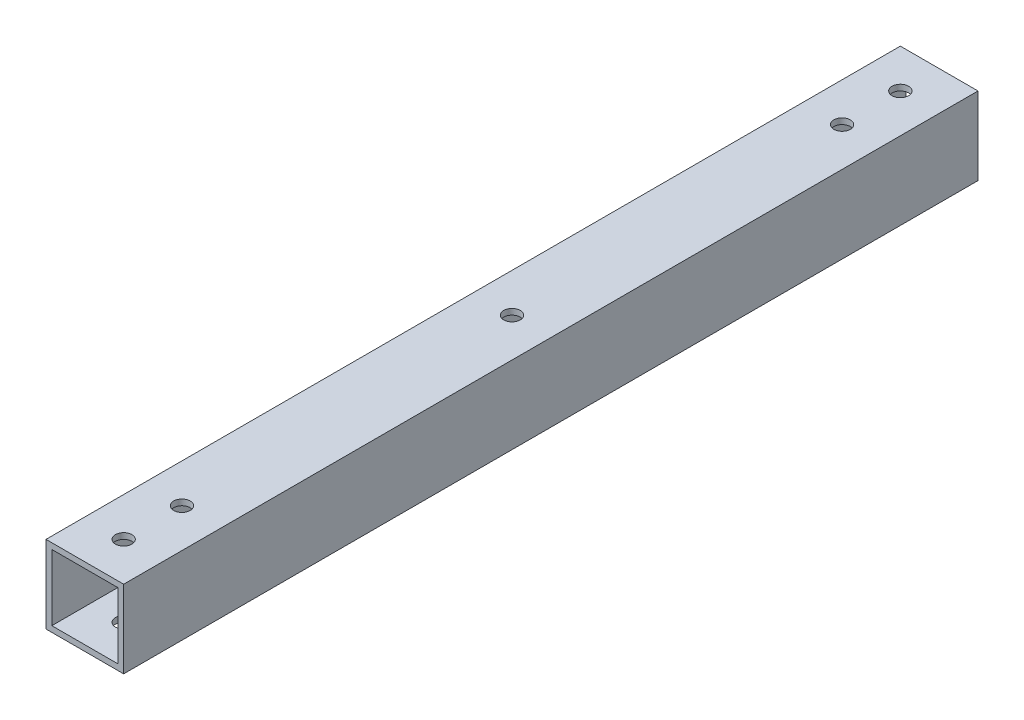
from build123d import *

# Parameters (mm, degrees)
SKETCH1_W           = 20
SKETCH1_H           = 20
SKETCH1_W_2         = 17
SKETCH1_H_2         = 17
BOSS_EXTRUDE1_DEPTH = 220
SKETCH2_R           = 2.125
CUT_EXTRUDE1_DEPTH  = 222.133443875


with BuildPart() as part:
    # Sketch1 → Boss-Extrude1 (new body)
    with BuildSketch(Plane.XY):
        Rectangle(SKETCH1_W, SKETCH1_H)
        Rectangle(SKETCH1_W_2, SKETCH1_H_2, mode=Mode.SUBTRACT)
    extrude(amount=-BOSS_EXTRUDE1_DEPTH)

    # Sketch2 → Cut-Extrude1 (cut, through all)
    with BuildSketch(Plane(origin=(0, 10, 0), x_dir=(1, 0, 0), z_dir=(0, 1, 0))):
        with Locations((0, 10)):
            Circle(SKETCH2_R)
        with Locations((0, 110)):
            Circle(SKETCH2_R)
        with Locations((0, 210)):
            Circle(SKETCH2_R)
        with Locations((0, 25)):
            Circle(SKETCH2_R)
        with Locations((0, 195)):
            Circle(SKETCH2_R)
    extrude(amount=-CUT_EXTRUDE1_DEPTH, mode=Mode.SUBTRACT)


solid = part.part
